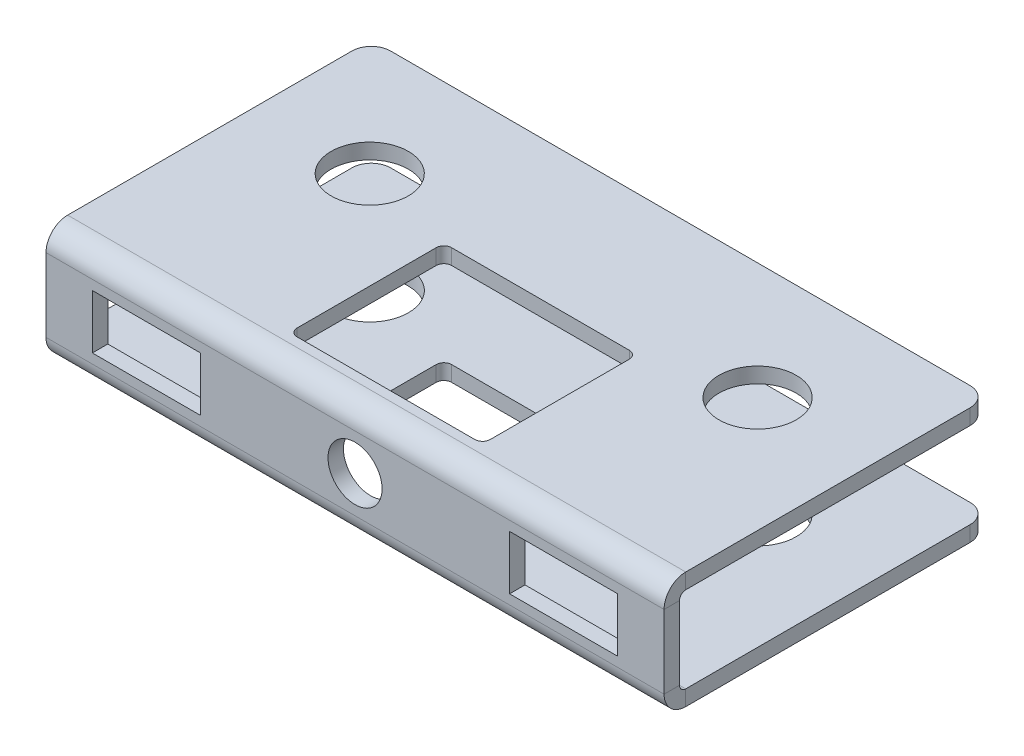
from build123d import *

# Parameters (mm, degrees)
SKETCH1_W                      = 80
SKETCH1_H                      = 2
BASE_FLANGE1_DEPTH             = 5.55
EDGE_FLANGE1_STRIP_W           = 9.6
EDGE_FLANGE1_STRIP_H           = 2
EDGE_FLANGE1_STRIP_CUT_DEPTH   = 80
EDGE_FLANGE1_STRIP_2_W         = 9.6
EDGE_FLANGE1_STRIP_2_H         = 2
EDGE_FLANGE1_STRIP_CUT_2_DEPTH = 80
EDGE_FLANGE1_DEPTH             = 80
EDGE_FLANGE1_BEND_DEPTH        = 80
SKETCH12_R                     = 3.5
SKETCH12_W                     = 14
SKETCH12_H                     = 7
CUT_EXTRUDE1_DEPTH             = 59.561185951
SKETCH13_W                     = 25
SKETCH13_H                     = 20
CUT_EXTRUDE2_DEPTH             = 59.617574157
FILLET1_R                      = 1
FILLET2_R                      = 2.5
SKETCH15_R                     = 5
CUT_EXTRUDE3_DEPTH             = 59.617574157


# Sheet-metal steps are written as plain solids
with BuildPart() as part:
    # Sketch1 → Base-Flange1 (new, symmetric)
    with BuildSketch(Plane(origin=(0, 0, 0), x_dir=(1, 0, 0), z_dir=(0, 1, 0))):
        with Locations((0, -1)):
            Rectangle(SKETCH1_W, SKETCH1_H)
    extrude(amount=BASE_FLANGE1_DEPTH, both=True)

    # Edge-Flange1 strip (across the edge) → Edge-Flange1 strip cut (cut)
    with BuildSketch(Plane(origin=(40, -5.55, 0), x_dir=(0, 1, 0), z_dir=(-1, 0, 0))):
        with Locations((-4, -1)):
            Rectangle(EDGE_FLANGE1_STRIP_W, EDGE_FLANGE1_STRIP_H)
    extrude(amount=EDGE_FLANGE1_STRIP_CUT_DEPTH, mode=Mode.SUBTRACT)

    # Edge-Flange1 strip 2 (across the edge) → Edge-Flange1 strip cut 2 (cut)
    with BuildSketch(Plane(origin=(-40, 5.55, 0), x_dir=(0, -1, 0), z_dir=(1, 0, 0))):
        with Locations((-4, -1)):
            Rectangle(EDGE_FLANGE1_STRIP_2_W, EDGE_FLANGE1_STRIP_2_H)
    extrude(amount=EDGE_FLANGE1_STRIP_CUT_2_DEPTH, mode=Mode.SUBTRACT)

    # Edge-Flange1 section (across the edge) → Edge-Flange1 (add)
    with BuildSketch(Plane(origin=(40, -5.55, 0), x_dir=(0, 1, 0), z_dir=(-1, 0, 0))):
        with BuildLine():
            Line((-2, 0.8), (-2, 40.1))
            Line((-2, 40.1), (0, 40.1))
            Line((0, 40.1), (0, 0.8))
            ThreePointArc((0, 0.8), (0.234314575, 0.234314575), (0.8, 0))
            Line((0.8, 0), (0.8, -2))
            ThreePointArc((0.8, -2), (-1.179898987, -1.179898987), (-2, 0.8))
        make_face()
    extrude(amount=EDGE_FLANGE1_DEPTH)

    # Edge-Flange1 section 2 (across the edge) → Edge-Flange1 bend (add)
    with BuildSketch(Plane(origin=(-40, 5.55, 0), x_dir=(0, -1, 0), z_dir=(1, 0, 0))):
        with BuildLine():
            Line((-2, 0.8), (-2, 40.1))
            Line((-2, 40.1), (0, 40.1))
            Line((0, 40.1), (0, 0.8))
            ThreePointArc((0, 0.8), (0.234314575, 0.234314575), (0.8, 0))
            Line((0.8, 0), (0.8, -2))
            ThreePointArc((0.8, -2), (-1.179898987, -1.179898987), (-2, 0.8))
        make_face()
    extrude(amount=EDGE_FLANGE1_BEND_DEPTH)

    # Sketch12 → Cut-Extrude1 (cut, through all)
    with BuildSketch(Plane.XY.offset(2)):
        Circle(SKETCH12_R)
        with Locations((-27, 0)):
            Rectangle(SKETCH12_W, SKETCH12_H)
        with Locations((27, 0)):
            Rectangle(SKETCH12_W, SKETCH12_H)
    extrude(amount=-CUT_EXTRUDE1_DEPTH, mode=Mode.SUBTRACT)

    # Sketch13 → Cut-Extrude2 (cut, through all)
    with BuildSketch(Plane(origin=(0, 7.55, 0), x_dir=(1, 0, 0), z_dir=(0, 1, 0))):
        with Locations((0, 12)):
            Rectangle(SKETCH13_W, SKETCH13_H)
    extrude(amount=-CUT_EXTRUDE2_DEPTH, mode=Mode.SUBTRACT)

    # Fillet1
    fillet1_edges = [part.edges().sort_by_distance(p)[0] for p in [
        (-12.5, -6.55, -2),
        (-12.5, -6.55, -22),
        (12.5, -6.55, -22),
        (12.5, -6.55, -2),
        (-12.5, 6.55, -2),
        (-12.5, 6.55, -22),
        (12.5, 6.55, -22),
        (12.5, 6.55, -2),
    ]]
    fillet(fillet1_edges, radius=FILLET1_R)

    # Fillet2
    fillet2_edges = [part.edges().sort_by_distance(p)[0] for p in [
        (40, -6.55, -40.1),
        (-40, -6.55, -40.1),
        (-40, 6.55, -40.1),
        (40, 6.55, -40.1),
    ]]
    fillet(fillet2_edges, radius=FILLET2_R)

    # Sketch15 → Cut-Extrude3 (cut, through all)
    with BuildSketch(Plane.XZ.offset(7.55)):
        with Locations(Location((25.1, -25, 0), (0, 0, 270))):
            Circle(SKETCH15_R)
        with Locations(Location((-25.1, -25, 0), (0, 0, 270))):
            Circle(SKETCH15_R)
    extrude(amount=-CUT_EXTRUDE3_DEPTH, mode=Mode.SUBTRACT)


solid = part.part
